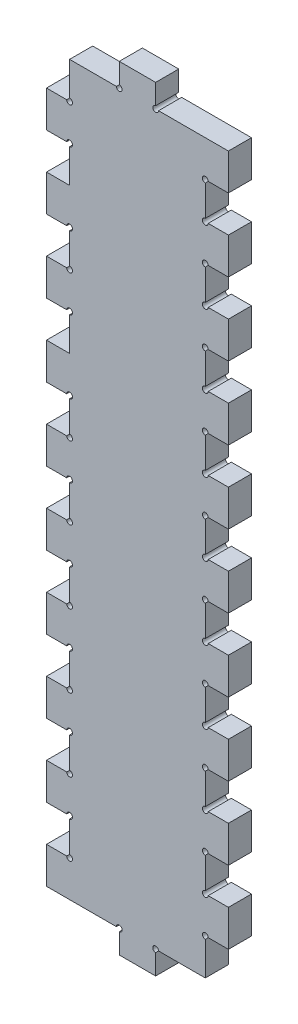
from build123d import *

# Parameters (mm, degrees)
BOSS_EXTRUDE1_DEPTH            = 6.35
F_1_16_0_0625_DIAMETER_HOLE1_D = 1.5875


# Read off the part's stored shape, not the designer's step: Boss-Extrude1
with BuildPart() as part:
    # Boss-Extrude1 outline → Boss-Extrude1 (new body)
    with BuildSketch(Plane.XY):
        Polygon((43.641394901, 180), (43.641394901, 190), (49.991394901, 190), (49.991394901, 200), (30, 200), (30, 206.35), (20, 206.35), (20, 200), (6.35, 200), (6.35, 190), (0, 190), (0, 180), (6.35, 180), (6.35, 170), (0, 170), (0, 160), (6.35, 160), (6.35, 150), (0, 150), (0, 140), (6.35, 140), (6.35, 130), (0, 130), (0, 120), (6.35, 120), (6.35, 110), (0, 110), (0, 100), (6.35, 100), (6.35, 90), (0, 90), (0, 80), (6.35, 80), (6.35, 70), (0, 70), (0, 60), (6.35, 60), (6.35, 50), (0, 50), (0, 40), (6.35, 40), (6.35, 30), (0, 30), (0, 20), (6.35, 20), (6.35, 10), (0, 10), (0, 0), (20, 0), (20, -6.35), (30, -6.35), (30, 0.011738555), (43.641394901, 0), (43.641394901, 10), (50, 10), (50, 20), (43.641394901, 20), (43.641394901, 30), (50, 30), (50, 40), (43.641394901, 40), (43.641394901, 50), (50, 50), (50, 60), (43.641394901, 60), (43.641394901, 70), (50, 70), (50, 80), (43.641394901, 80), (43.641394901, 90), (50, 90), (50, 100), (43.641394901, 100), (43.641394901, 110), (50, 110), (50, 120), (43.641394901, 120), (43.641394901, 130), (50, 130), (50, 140), (43.641394901, 140), (43.641394901, 150), (50, 150), (50, 160), (43.641394901, 160), (43.641394901, 170), (50, 170), (50, 180), align=None)
    extrude(amount=BOSS_EXTRUDE1_DEPTH)

    # 1/16 (0.0625) Diameter Hole1 (through all)
    with Locations(Plane.XY.offset(6.35)):
        with Locations((6.35, 190), (6.35, 180), (6.35, -2541.231306405), (20, 200), (30, 200), (43.641394901, 190), (43.641394901, 180), (43.641394901, 170), (43.641394901, 160), (43.641394901, 150), (6.35, 150), (6.35, 160), (6.35, 140), (6.35, -2581.231306405), (6.35, 120), (6.35, 110), (6.35, 100), (6.35, 90), (6.35, 80), (6.35, 70), (6.35, 60), (6.35, 50), (6.35, 40), (6.35, 30), (6.35, 20), (6.35, 10), (43.641394901, 140), (43.641394901, 130), (43.641394901, 120), (43.641394901, 110), (43.641394901, 100), (43.641394901, 90), (43.641394901, 80), (43.641394901, 70), (43.641394901, 60), (43.641394901, 50), (43.641394901, 40), (43.641394901, 30), (43.641394901, 20), (43.641394901, 10), (30, 0.011738555), (20, 0)):
            Hole(F_1_16_0_0625_DIAMETER_HOLE1_D / 2)


solid = part.part
